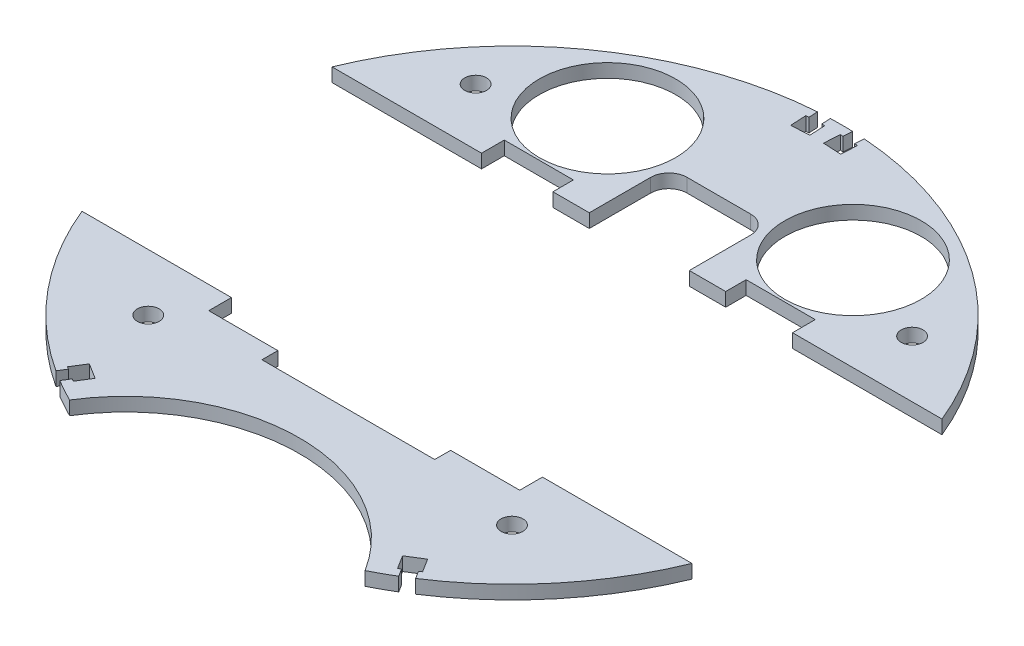
from build123d import *

# Parameters (mm, degrees)
BOSS_EXTRUDE1_DEPTH  = 3
SOLENOID_PLACEMENT_W = 38
SOLENOID_PLACEMENT_H = 64
CUT_EXTRUDE1_DEPTH   = 103.574363269
SKETCH3_R            = 12
CUT_EXTRUDE3_DEPTH   = 103.574363269
SKETCH4_R            = 2.4
CUT_EXTRUDE4_DEPTH   = 103.574363269
CUT_EXTRUDE2_DEPTH   = 103.574363269
CUT_EXTRUDE5_DEPTH   = 99.819279495
SKETCH6_R            = 15
CUT_EXTRUDE10_DEPTH  = 99.819279495
CUT_EXTRUDE11_DEPTH  = 99.819279495


with BuildPart() as part:
    # Sketch1 → Boss-Extrude1 (new body)
    with BuildSketch(Plane(origin=(0, 0, 0), x_dir=(1, 0, 0), z_dir=(0, 1, 0))):
        with BuildLine():
            ThreePointArc((32.48910875, -64.812867647), (0, 72.5), (-32.48910875, -64.812867647))
            ThreePointArc((-32.48910875, -64.812867647), (0, -46.75), (32.48910875, -64.812867647))
        make_face()
    extrude(amount=BOSS_EXTRUDE1_DEPTH)

    # solenoid placement → Cut-Extrude1 (cut, through all)
    with BuildSketch(Plane(origin=(0, 3, 0), x_dir=(1, 0, 0), z_dir=(0, 1, 0))):
        with Locations((0, -4)):
            Rectangle(SOLENOID_PLACEMENT_W, SOLENOID_PLACEMENT_H)
    extrude(amount=-CUT_EXTRUDE1_DEPTH, mode=Mode.SUBTRACT)

    # Sketch3 → Cut-Extrude3 (cut, through all)
    with BuildSketch(Plane(origin=(0, 3, 0), x_dir=(1, 0, 0), z_dir=(0, 1, 0))):
        with Locations((27, 48)):
            Circle(SKETCH3_R)
        with Locations((-27, 48)):
            Circle(SKETCH3_R)
    extrude(amount=-CUT_EXTRUDE3_DEPTH, mode=Mode.SUBTRACT)

    # Sketch4 → Cut-Extrude4 (cut, through all)
    with BuildSketch(Plane(origin=(0, 3, 0), x_dir=(1, 0, 0), z_dir=(0, 1, 0))):
        with Locations((40, -40)):
            Circle(SKETCH4_R)
        with Locations((-40, -40)):
            Circle(SKETCH4_R)
        with Locations((48, 40)):
            Circle(SKETCH4_R)
        with Locations((-48, 40)):
            Circle(SKETCH4_R)
    extrude(amount=-CUT_EXTRUDE4_DEPTH, mode=Mode.SUBTRACT)

    # Sketch2 → Cut-Extrude2 (cut, through all)
    with BuildSketch(Plane(origin=(0, 3, 0), x_dir=(1, 0, 0), z_dir=(0, 1, 0))):
        with BuildLine():
            Line((34.2, -27.5), (34.2, -32.5))
            Line((34.2, -32.5), (22.2, -32.5))
            Line((22.2, -32.5), (19, -32.5))
            Line((19, -32.5), (19, 32.5))
            Line((19, 32.5), (22.2, 32.5))
            Line((22.2, 32.5), (34.2, 32.5))
            Line((34.2, 32.5), (34.2, 27.5))
            Line((34.2, 27.5), (67.082039325, 27.5))
            ThreePointArc((67.082039325, 27.5), (72.5, 0), (67.082039325, -27.5))
            Line((67.082039325, -27.5), (34.2, -27.5))
        make_face()
        with BuildLine():
            Line((-34.2, -32.5), (-22.2, -32.5))
            Line((-22.2, -32.5), (-19, -32.5))
            Line((-19, -32.5), (-19, 32.5))
            Line((-19, 32.5), (-22.2, 32.5))
            Line((-22.2, 32.5), (-34.2, 32.5))
            Line((-34.2, 32.5), (-34.2, 27.5))
            Line((-34.2, 27.5), (-67.082039325, 27.5))
            ThreePointArc((-67.082039325, 27.5), (-72.5, 0), (-67.082039325, -27.5))
            Line((-67.082039325, -27.5), (-34.2, -27.5))
            Line((-34.2, -27.5), (-34.2, -32.5))
        make_face()
    extrude(amount=-CUT_EXTRUDE2_DEPTH, mode=Mode.SUBTRACT)


with BuildPart() as cut_extrude2_piece_1:
    # of the separate pieces the step leaves, piece 1, a body of its own (cut_extrude2_pieces)
    add(part.part.solids().sort_by_distance((67.082039325, 0, -27.5))[0])

    # Sketch5 → Cut-Extrude5 (cut, through all)
    with BuildSketch(Plane(origin=(0, 3, 0), x_dir=(1, 0, 0), z_dir=(0, 1, 0))):
        with BuildLine():
            Line((-11, 41.5), (-11, 28))
            Line((-11, 28), (11, 28))
            Line((11, 28), (11, 41.5))
            ThreePointArc((11, 41.5), (9.828427125, 44.328427125), (7, 45.5))
            Line((7, 45.5), (-7, 45.5))
            ThreePointArc((-7, 45.5), (-9.828427125, 44.328427125), (-11, 41.5))
        make_face()
    extrude(amount=-CUT_EXTRUDE5_DEPTH, mode=Mode.SUBTRACT)

    # Sketch6 → Cut-Extrude10 (cut, through all)
    with BuildSketch(Plane(origin=(0, 3, 0), x_dir=(-1, 0, 0), z_dir=(0, 1, 0))):
        with Locations((-27, -48)):
            Circle(SKETCH6_R)
        with Locations((27, -48)):
            Circle(SKETCH6_R)
    extrude(amount=-CUT_EXTRUDE10_DEPTH, mode=Mode.SUBTRACT)


with BuildPart() as cut_extrude2_piece_2:
    # of the separate pieces the step leaves, piece 2, a body of its own (cut_extrude2_pieces)
    add(part.part.solids().sort_by_distance((32.48910875, 0, 64.812867647))[0])


with BuildPart() as cut_extrude11_tool:
    # Sketch7 → Cut-Extrude11 (new, through all)
    with BuildSketch(Plane(origin=(0, 3, 0), x_dir=(1, 0, 0), z_dir=(0, 1, 0))):
        Polygon((-5.037834787, 70.332728659), (-5.686943985, 70.298710288), (-5.503768138, 66.803506916), (-1.509249999, 67.012850741), (-1.692425846, 70.508054113), (-2.341535043, 70.474035741), (-2.446206956, 72.471294811), (-5.1425067, 72.329987729), align=None)
        Polygon((5.686943985, 70.298710288), (5.037834787, 70.332728659), (5.1425067, 72.329987729), (2.446206956, 72.471294811), (2.341535043, 70.474035741), (1.692425846, 70.508054113), (1.509249999, 67.012850741), (5.503768138, 66.803506916), align=None)
        Polygon((38.504173058, -59.071999772), (39.055404321, -58.727552251), (37.200686896, -55.759383914), (33.808494511, -57.879060971), (35.663211936, -60.847229307), (36.214443199, -60.502781786), (37.274281727, -62.198877978), (39.564011587, -60.768095965), align=None)
        Polygon((-39.055404321, -58.727552251), (-38.504173058, -59.071999772), (-39.564011587, -60.768095965), (-37.274281727, -62.198877978), (-36.214443199, -60.502781786), (-35.663211936, -60.847229307), (-33.808494511, -57.879060971), (-37.200686896, -55.759383914), align=None)
    extrude(amount=-CUT_EXTRUDE11_DEPTH)


with BuildPart() as cut_extrude2_piece_1_1:
    add(cut_extrude2_piece_1.part)

    # Cut-Extrude11: cut by cut_extrude11_tool
    add(cut_extrude11_tool.part, mode=Mode.SUBTRACT)


with BuildPart() as cut_extrude2_piece_2_1:
    add(cut_extrude2_piece_2.part)

    # Cut-Extrude11: cut by cut_extrude11_tool
    add(cut_extrude11_tool.part, mode=Mode.SUBTRACT)


solid = Compound([cut_extrude2_piece_1_1.part, cut_extrude2_piece_2_1.part])
